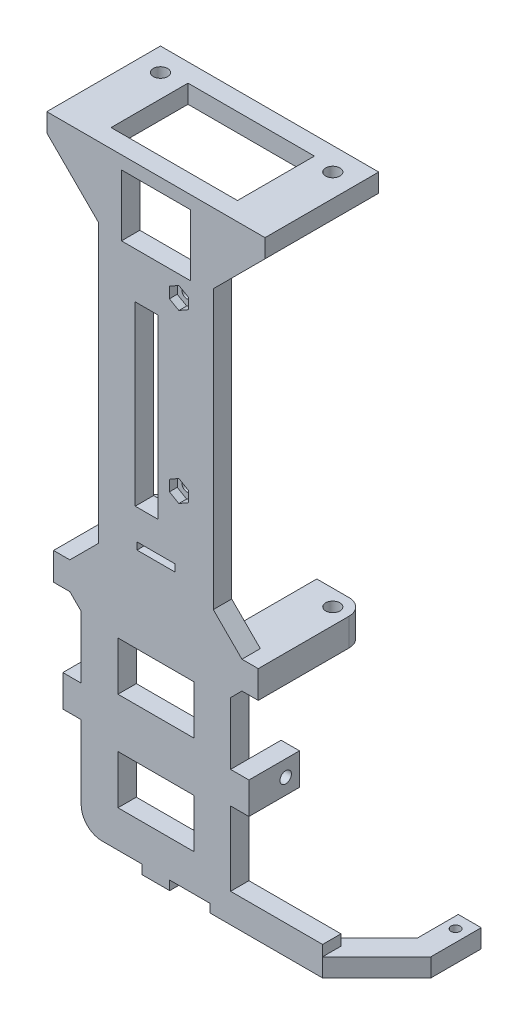
from build123d import *

# Parameters (mm, degrees)
EXTRUDE_1_DEPTH     = 4
SKETCH_2_W          = 15
SKETCH_2_H          = 13.3866
CUT_EXTRUDE_1_DEPTH = 121.91505324
SKETCH_3_W          = 10
SKETCH_3_H          = 10
SKETCH_3_R          = 1.55
SKETCH_3_H_2        = 14.755
EXTRUDE_2_DEPTH     = 4
EXTRUDE_3_DEPTH     = 4
EXTRUDE_4_DEPTH     = 4
SKETCH_7_W          = 27.52
SKETCH_7_H          = 4
EXTRUDE_5_DEPTH     = 4
SKETCH_8_W          = 24.546067812
SKETCH_8_H          = 6.33
EXTRUDE_6_DEPTH     = 4
SKETCH_11_W         = 16.52
SKETCH_11_H         = 10.61
CUT_EXTRUDE_2_DEPTH = 132.394668556
SKETCH_12_W         = 11
SKETCH_12_H         = 6.89
SKETCH_12_R         = 1.25
EXTRUDE_6711_DEPTH  = 4
SKETCH_14_R         = 1
CUT_EXTRUDE_3_DEPTH = 131.700110654
SKETCH_15_R         = 0.9
EXTRUDE_9_DEPTH     = 1
FILLET_1_R          = 0.9
CUT_EXTRUDE_START   = -1.7
SKETCH_16_R         = 1
CUT_EXTRUDE_4_DEPTH = 1.7
CUT_EXTRUDE_5_DEPTH = 131.700110654
SKETCH_19_W         = 5
SKETCH_19_H         = 38.5268
SKETCH_19_W_2       = 8.236887868
SKETCH_19_H_2       = 1.55
CUT_EXTRUDE_6_DEPTH = 131.700110654
EXTRUDE_12_DEPTH    = 23.28
CUT_EXTRUDE_7_REACH = 99.296
SKETCH_23_R         = 1.55
EXTRUDE_13_DEPTH    = 4
CUT_EXTRUDE_START_2 = -19.28
CUT_EXTRUDE_8_DEPTH = 19.48
SKETCH_26_W         = 10.1
SKETCH_26_H         = 2
EXTRUDE_14_DEPTH    = 3


# Read off the part's stored shape, not the designer's step: 切除-拉伸8
with BuildPart() as part:
    # 草图1 → 凸台-拉伸1 (new body)
    with BuildSketch(Plane.XY):
        with BuildLine():
            Line((-16.26, -7.25), (-16.26, 119.75))
            Line((-16.26, 119.75), (16.26, 119.75))
            Line((16.26, 119.75), (16.26, -7.25))
            ThreePointArc((16.26, -7.25), (14.939051583, -10.439051583), (11.75, -11.76))
            Line((11.75, -11.76), (-11.75, -11.76))
            ThreePointArc((-11.75, -11.76), (-14.939051583, -10.439051583), (-16.26, -7.25))
        make_face()
    extrude(amount=EXTRUDE_1_DEPTH)

    # 草图2 → 切除-拉伸1 (cut, through all)
    with BuildSketch(Plane(origin=(0, 0, 0), x_dir=(-1, 0, 0), z_dir=(0, 0, -1))):
        with Locations((0, 110.2067)):
            Rectangle(SKETCH_2_W, SKETCH_2_H)
    extrude(amount=-CUT_EXTRUDE_1_DEPTH, mode=Mode.SUBTRACT)

    # 草图3 → 凸台-拉伸2 (add)
    # profile 1 of 2: a face of its own
    with BuildSketch(Plane(origin=(0, 119.75, 0), x_dir=(1, 0, 0), z_dir=(0, 1, 0))):
        with Locations((-18.76, 15.755)):
            Rectangle(SKETCH_3_W, SKETCH_3_H)
        with Locations(Location((-18.76, 15.755, 0), (0, 0, 270))):
            Circle(SKETCH_3_R, mode=Mode.SUBTRACT)
    # profile 2 of 2: a face of its own
    with BuildSketch(Plane(origin=(0, 119.75, 0), x_dir=(1, 0, 0), z_dir=(0, 1, 0))):
        with Locations((-18.76, 3.3775)):
            Rectangle(SKETCH_3_W, SKETCH_3_H_2)
    extrude_2 = extrude(amount=-EXTRUDE_2_DEPTH)

    # 镜向1: 凸台-拉伸2 across plane
    add(extrude_2.mirror(Plane(origin=(0, 0, 0), x_dir=(0, 0, 1), z_dir=(1, 0, 0))))

    # 草图6 → 凸台-拉伸4 (add)
    with BuildSketch(Plane.XY.offset(4)):
        Polygon((-16.26, 115.75), (-23.76, 115.75), (-16.26, 108.25), align=None)
        Polygon((16.26, 115.75), (16.26, 108.25), (23.76, 115.75), align=None)
    extrude(amount=-EXTRUDE_4_DEPTH)

    # 草图7 → 凸台-拉伸5 (add)
    with BuildSketch(Plane(origin=(0, 119.75, 0), x_dir=(1, 0, 0), z_dir=(0, 1, 0))):
        with Locations((0, 18.755)):
            Rectangle(SKETCH_7_W, SKETCH_7_H)
    extrude(amount=-EXTRUDE_5_DEPTH)



with BuildPart() as body_2:
    # 草图5 → 凸台-拉伸3 (new body)
    with BuildSketch(Plane(origin=(0, -13.58, 0), x_dir=(1, 0, 0), z_dir=(0, 1, 0))):
        Polygon((47.78, 9.855), (43.08, 9.855), (29.225, -4), (36.296067812, -4), (48.08, 7.783932188), (48.08, 9.855), align=None)
        with BuildLine():
            Line((47.78, 18.755), (43.08, 18.755))
            Line((43.08, 18.755), (43.08, 9.855))
            Line((43.08, 9.855), (47.78, 9.855))
            Line((47.78, 9.855), (47.78, 15.105))
            Line((47.78, 15.105), (46.239934208, 15.105))
            ThreePointArc((46.239934208, 15.105), (44.48, 15.755), (46.239934208, 16.405))
            Line((46.239934208, 16.405), (47.78, 16.405))
            Line((47.78, 16.405), (47.78, 18.755))
        make_face()
        with BuildLine():
            Line((48.08, 18.755), (47.78, 18.755))
            Line((47.78, 18.755), (47.78, 16.405))
            Line((47.78, 16.405), (46.239934208, 16.405))
            ThreePointArc((46.239934208, 16.405), (46.418065618, 16.10145764), (46.48, 15.755))
            ThreePointArc((46.48, 15.755), (46.418065618, 15.40854236), (46.239934208, 15.105))
            Line((46.239934208, 15.105), (47.78, 15.105))
            Line((47.78, 15.105), (47.78, 9.855))
            Line((47.78, 9.855), (48.08, 9.855))
            Line((48.08, 9.855), (48.08, 18.755))
        make_face()
    extrude(amount=EXTRUDE_3_DEPTH)


with BuildPart() as part_1:
    add(part.part)

    add(body_2.part)  # 凸台-拉伸6 merges body 2
    # 草图8 → 凸台-拉伸6 (add)
    with BuildSketch(Plane.XY.offset(4)):
        with Locations((24.023033906, -10.415)):
            Rectangle(SKETCH_8_W, SKETCH_8_H)
    extrude(amount=-EXTRUDE_6_DEPTH)

    # 草图11 → 切除-拉伸2 (cut, through all)
    with BuildSketch(Plane.XY.offset(4)):
        with Locations((0, 1.545)):
            Rectangle(SKETCH_11_W, SKETCH_11_H)
        with Locations((0, 22.955)):
            Rectangle(SKETCH_11_W, SKETCH_11_H)
    extrude(amount=-CUT_EXTRUDE_2_DEPTH, mode=Mode.SUBTRACT)

    # 草图12 → Extrude 6711 (add)
    with BuildSketch(Plane.ZY.offset(16.26)):
        with Locations((-1.5, 12.295)):
            Rectangle(SKETCH_12_W, SKETCH_12_H)
        with Locations((-4, 12.25)):
            Circle(SKETCH_12_R, mode=Mode.SUBTRACT)
    extrude_6711 = extrude(amount=EXTRUDE_6711_DEPTH)

    # 镜向4: Extrude 6711 across plane
    add(extrude_6711.mirror(Plane(origin=(0, 0, 0), x_dir=(0, 0, 1), z_dir=(1, 0, 0))))

    # 草图14 → 切除-拉伸3 (cut, through all)
    with BuildSketch(Plane(origin=(0, 0, 0), x_dir=(-1, 0, 0), z_dir=(0, 0, -1))):
        with Locations((-5, 62.6)):
            Circle(SKETCH_14_R)
        with Locations((-5, 99)):
            Circle(SKETCH_14_R)
    extrude(amount=-CUT_EXTRUDE_3_DEPTH, mode=Mode.SUBTRACT)

    # 草图15 → 凸台-拉伸9 (add)
    with BuildSketch(Plane(origin=(0, 0, 0), x_dir=(-1, 0, 0), z_dir=(0, 0, -1))):
        with Locations(Location((-5, 94.35, 0), (0, 0, 180))):
            Circle(SKETCH_15_R)
        with Locations(Location((-5, 57.98, 0), (0, 0, 180))):
            Circle(SKETCH_15_R)
    extrude(amount=EXTRUDE_9_DEPTH)

    # 圆角1
    fillet_1_edges = [part_1.edges().sort_by_distance(p)[0] for p in [
        (4.1, 94.35, -1),
        (4.1, 57.98, -1),
    ]]
    fillet(fillet_1_edges, radius=FILLET_1_R)

    # 草图16 → 切除-拉伸4 (cut)
    # profile 1 of 2: a face of its own
    with BuildSketch(Plane.XY.offset(4).offset(CUT_EXTRUDE_START)):
        Polygon((7.05, 61.416431948), (7.05, 63.783568052), (5, 64.967136104), (2.95, 63.783568052), (2.95, 61.416431948), (5, 60.232863896), align=None)
        with Locations(Location((5, 62.6, 0), (0, 0, 180))):
            Circle(SKETCH_16_R, mode=Mode.SUBTRACT)
    # profile 2 of 2: a face of its own
    with BuildSketch(Plane.XY.offset(4).offset(CUT_EXTRUDE_START)):
        Polygon((2.95, 97.816431948), (5, 96.632863896), (7.05, 97.816431948), (7.05, 100.183568052), (5, 101.367136104), (2.95, 100.183568052), align=None)
        with Locations(Location((5, 99, 0), (0, 0, 180))):
            Circle(SKETCH_16_R, mode=Mode.SUBTRACT)
    extrude(amount=CUT_EXTRUDE_4_DEPTH, mode=Mode.SUBTRACT)

    # 草图17 → 切除-拉伸5 (cut, symmetric)
    with BuildSketch(Plane(origin=(0, 0, 0), x_dir=(-1, 0, 0), z_dir=(0, 0, -1))):
        Polygon((-12.5, 104.49), (-16.26, 108.25), (-16.26, 40.2266), (-12.5, 43.9866), align=None)
    cut_extrude_5 = extrude(amount=CUT_EXTRUDE_5_DEPTH, both=True, mode=Mode.SUBTRACT)

    # 镜向2: 切除-拉伸5 across plane
    add(cut_extrude_5.mirror(Plane(origin=(0, 0, 0), x_dir=(0, 0, 1), z_dir=(1, 0, 0))), mode=Mode.SUBTRACT)

    # 草图19 → 切除-拉伸6 (cut, through all)
    with BuildSketch(Plane(origin=(0, 0, 0), x_dir=(-1, 0, 0), z_dir=(0, 0, -1))):
        with Locations((2, 74.25)):
            Rectangle(SKETCH_19_W, SKETCH_19_H)
        with Locations((0, 47.675)):
            Rectangle(SKETCH_19_W_2, SKETCH_19_H_2)
    extrude(amount=-CUT_EXTRUDE_6_DEPTH, mode=Mode.SUBTRACT)

    # 草图22 → 凸台-拉伸12 (add)
    with BuildSketch(Plane.XY.offset(4)):
        with BuildLine():
            Line((16.26, 32.704986911), (16.26, 31.75))
            Line((16.26, 31.75), (22.285, 31.75))
            Line((22.285, 31.75), (22.285, 37.75))
            Line((22.285, 37.75), (11.75, 37.75))
            Line((11.75, 37.75), (11.75, 36.36))
            ThreePointArc((11.75, 36.36), (14.652551493, 35.331521301), (16.26, 32.704986911))
        make_face()
    extrude_12 = extrude(amount=-EXTRUDE_12_DEPTH)

    # 草图23 → 切除-拉伸7 (cut, up to next)
    with BuildSketch(Plane(origin=(0, 37.75, 0), x_dir=(1, 0, 0), z_dir=(0, 1, 0)), mode=Mode.PRIVATE) as cut_extrude_7_sk1:
        with Locations(Location((18.76, 15.755, 0), (0, 0, 270))):
            Circle(SKETCH_23_R)
    cut_extrude_7_tool1 = extrude(cut_extrude_7_sk1.sketch, amount=-CUT_EXTRUDE_7_REACH, mode=Mode.PRIVATE) & part_1.part
    # 草图23 → 切除-拉伸7 (cut, up to next)
    with BuildSketch(Plane(origin=(0, 37.75, 0), x_dir=(1, 0, 0), z_dir=(0, 1, 0)), mode=Mode.PRIVATE) as cut_extrude_7_sk2:
        with BuildLine():
            ThreePointArc((18.76, 19.28), (21.252551404, 18.247551404), (22.285, 15.755))
            Line((22.285, 15.755), (22.285, 19.28))
            Line((22.285, 19.28), (18.76, 19.28))
        make_face()
    cut_extrude_7_tool2 = extrude(cut_extrude_7_sk2.sketch, amount=-CUT_EXTRUDE_7_REACH, mode=Mode.PRIVATE) & part_1.part
    cut_extrude_7_1 = cut_extrude_7_tool1.solids().sort_by_distance((18.76, 37.75, -15.755))[0]
    add(cut_extrude_7_1, mode=Mode.SUBTRACT)
    cut_extrude_7_2 = cut_extrude_7_tool2.solids().sort_by_distance((21.497628, 37.75, -18.492628))[0]
    add(cut_extrude_7_2, mode=Mode.SUBTRACT)
    cut_extrude_7 = cut_extrude_7_1 + cut_extrude_7_2  # 切除-拉伸7 as one shape, for the pattern or mirror that repeats it

    # 草图24 → 凸台-拉伸13 (add)
    with BuildSketch(Plane.XY.offset(4)):
        Polygon((16.26, 40.2266), (18.7366, 37.75), (18.7366, 31.75), (16.26, 29.2734), align=None)
    extrude_13 = extrude(amount=-EXTRUDE_13_DEPTH)

    # 镜向3: 凸台-拉伸12, 切除-拉伸7, 凸台-拉伸13 across plane
    add(extrude_12.mirror(Plane(origin=(0, 0, 0), x_dir=(0, 0, 1), z_dir=(1, 0, 0))))
    add(cut_extrude_7.mirror(Plane(origin=(0, 0, 0), x_dir=(0, 0, 1), z_dir=(1, 0, 0))), mode=Mode.SUBTRACT)
    add(extrude_13.mirror(Plane(origin=(0, 0, 0), x_dir=(0, 0, 1), z_dir=(1, 0, 0))))

    # 切除-拉伸8 outline → 切除-拉伸8 (cut)
    with BuildSketch(Plane.XY.offset(CUT_EXTRUDE_START_2)):
        with BuildLine():
            ThreePointArc((-16.26, 31.75), (-16.176051621, 32.616121846), (-15.927331684, 33.45))
            Line((-15.927331684, 33.45), (-22.285, 33.45))
            Line((-22.285, 33.45), (-22.285, 31.75))
            Line((-22.285, 31.75), (-16.26, 31.75))
        make_face()
    extrude(amount=CUT_EXTRUDE_8_DEPTH, mode=Mode.SUBTRACT)

    # 草图26 → 凸台-拉伸14 (add, symmetric)
    with BuildSketch(Plane(origin=(0, 0, 0), x_dir=(0, 0, -1), z_dir=(1, 0, 0))):
        with Locations((1.05, -12.76)):
            Rectangle(SKETCH_26_W, SKETCH_26_H)
        Polygon((8.1, -11.76), (8.1, -13.76), (6.1, -13.76), (6.1, -11.76), (6.1, -10.76), (7.1, -10.76), align=None)
    extrude(amount=EXTRUDE_14_DEPTH, both=True)


solid = part_1.part
